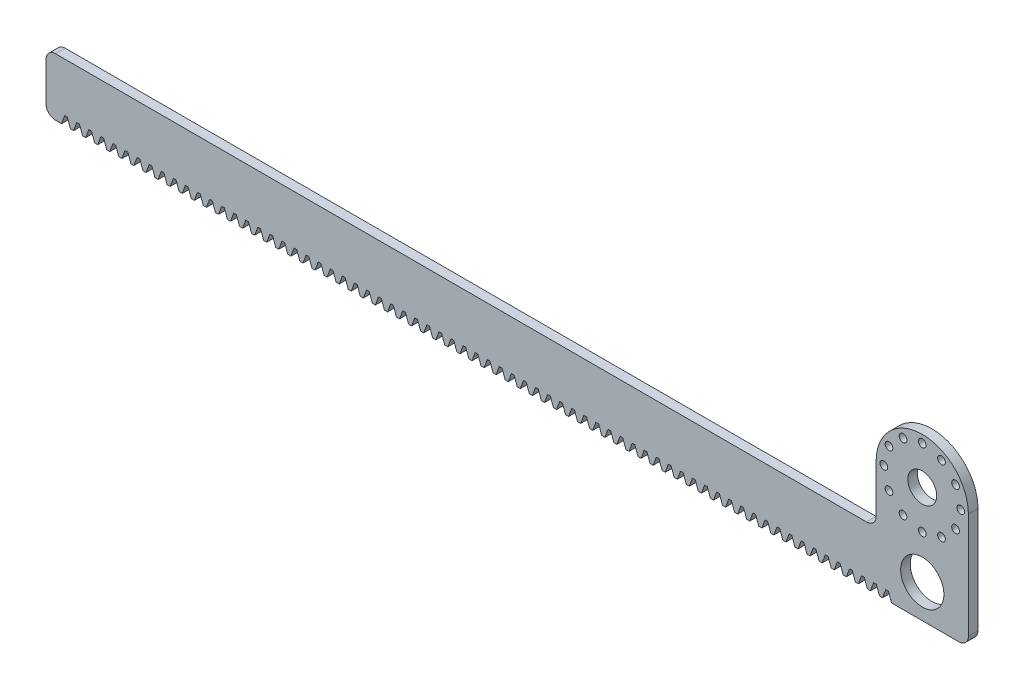
from build123d import *

# Parameters (mm, degrees)
SKETCH1_R           = 14.2875
SKETCH1_R_2         = 2.54
SKETCH1_R_3         = 9.525
BOSS_EXTRUDE1_DEPTH = 6.35
FILLET2_R           = 6.35
CUT_EXTRUDE1_DEPTH  = 619.896683543
LPATTERN1_COUNT     = 69
LPATTERN1_PITCH     = 7.979645331


with BuildPart() as part:
    # Sketch1 → Boss-Extrude1 (new body)
    with BuildSketch(Plane.XY):
        with BuildLine():
            Line((0, 38.1), (0, 0))
            Line((0, 0), (609.6, 0))
            Line((609.6, 0), (609.6, 76.2))
            ThreePointArc((609.6, 76.2), (579.12, 106.68), (548.64, 76.2))
            Line((548.64, 76.2), (548.64, 38.1))
            Line((548.64, 38.1), (40.53078, 38.1))
            Line((40.53078, 38.1), (0, 38.1))
        make_face()
        with Locations((579.12, 22.108627903)):
            Circle(SKETCH1_R, mode=Mode.SUBTRACT)
        with Locations((579.12, 50.8)):
            Circle(SKETCH1_R_2, mode=Mode.SUBTRACT)
        with Locations((566.42, 54.202954744)):
            Circle(SKETCH1_R_2, mode=Mode.SUBTRACT)
        with Locations((591.82, 54.202954744)):
            Circle(SKETCH1_R_2, mode=Mode.SUBTRACT)
        with Locations((557.122954744, 63.5)):
            Circle(SKETCH1_R_2, mode=Mode.SUBTRACT)
        with Locations((601.117045256, 63.5)):
            Circle(SKETCH1_R_2, mode=Mode.SUBTRACT)
        with Locations((553.72, 76.2)):
            Circle(SKETCH1_R_2, mode=Mode.SUBTRACT)
        with Locations((579.12, 76.2)):
            Circle(SKETCH1_R_3, mode=Mode.SUBTRACT)
        with Locations((604.52, 76.2)):
            Circle(SKETCH1_R_2, mode=Mode.SUBTRACT)
        with Locations((557.122954744, 88.9)):
            Circle(SKETCH1_R_2, mode=Mode.SUBTRACT)
        with Locations((601.117045256, 88.9)):
            Circle(SKETCH1_R_2, mode=Mode.SUBTRACT)
        with Locations((566.42, 98.197045256)):
            Circle(SKETCH1_R_2, mode=Mode.SUBTRACT)
        with Locations((591.82, 98.197045256)):
            Circle(SKETCH1_R_2, mode=Mode.SUBTRACT)
        with Locations((579.12, 101.6)):
            Circle(SKETCH1_R_2, mode=Mode.SUBTRACT)
    extrude(amount=BOSS_EXTRUDE1_DEPTH)

    # Fillet2
    fillet2_edges = [part.edges().sort_by_distance(p)[0] for p in [
        (0, 38.1, 3.175),
        (0, 0, 3.175),
        (548.64, 38.1, 3.175),
        (609.6, 0, 3.175),
    ]]
    fillet(fillet2_edges, radius=FILLET2_R)

    # Sketch2 → Cut-Extrude1 (cut, through all)
    with BuildSketch(Plane.XY.offset(6.35)):
        Polygon((552.86876001, 0), (558.8, 0), (556.719910111, 5.715), (554.948849899, 5.715), align=None)
    cut_extrude1 = extrude(amount=-CUT_EXTRUDE1_DEPTH, mode=Mode.SUBTRACT)

    # LPattern1: Cut-Extrude1 ×69
    with Locations(*[(-i * LPATTERN1_PITCH, 0, 0) for i in range(1, LPATTERN1_COUNT)]):
        add(cut_extrude1, mode=Mode.SUBTRACT)


solid = part.part
